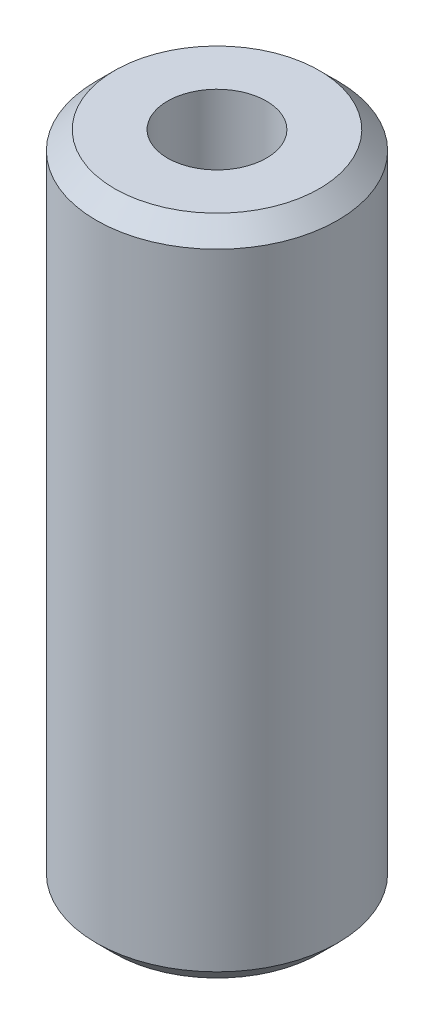
from build123d import *

# Parameters (mm, degrees)
SKETCH1_R           = 10
BOSS_EXTRUDE1_DEPTH = 54.890281674
SKETCH2_R           = 4.098788579
CUT_EXTRUDE1_DEPTH  = 57.682828283
CHAMFER1_SIZE       = 1.515696355


with BuildPart() as part:
    # Sketch1 → Boss-Extrude1 (new body)
    with BuildSketch(Plane(origin=(0, 0, 0), x_dir=(1, 0, 0), z_dir=(0, 1, 0))):
        Circle(SKETCH1_R)
    extrude(amount=BOSS_EXTRUDE1_DEPTH)

    # Sketch2 → Cut-Extrude1 (cut, through all)
    with BuildSketch(Plane(origin=(0, 0, 0), x_dir=(1, 0, 0), z_dir=(0, 1, 0))):
        Circle(SKETCH2_R)
    extrude(amount=CUT_EXTRUDE1_DEPTH, mode=Mode.SUBTRACT)

    # Chamfer1
    chamfer1_edges = [part.edges().sort_by_distance(p)[0] for p in [
        (-10, 54.890281674, 0),
        (-10, 0, 0),
    ]]
    chamfer(chamfer1_edges, length=CHAMFER1_SIZE)


solid = part.part
